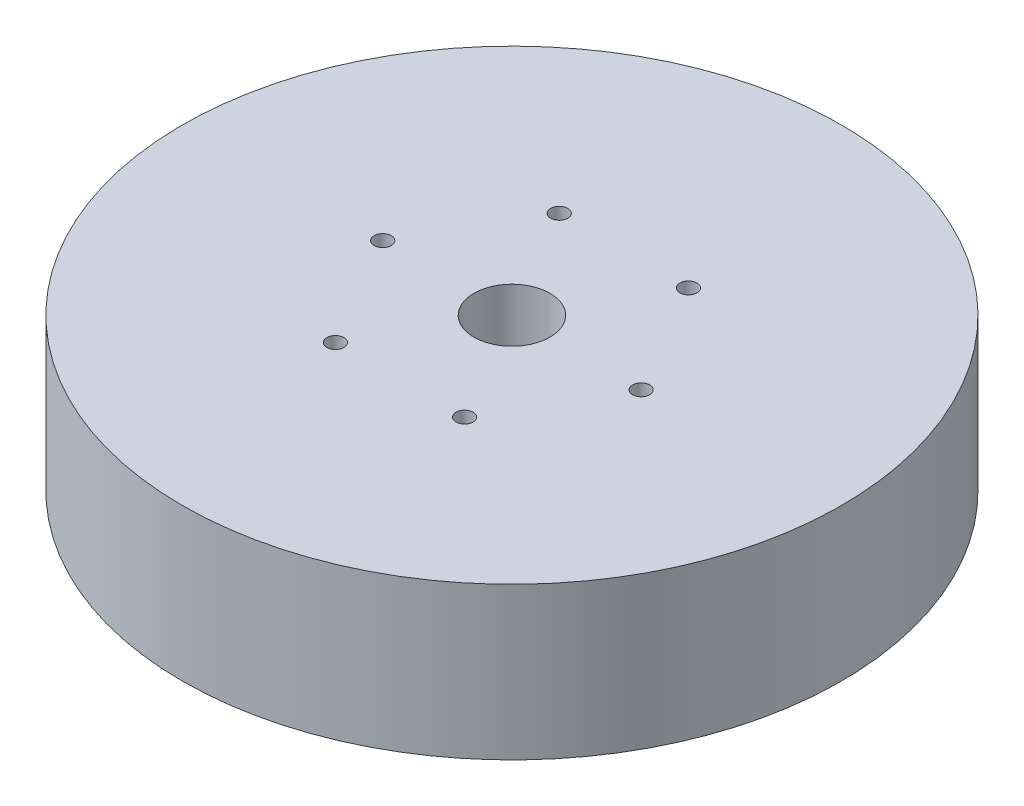
from build123d import *

# Parameters (mm, degrees)
SKETCH1_R           = 65
BOSS_EXTRUDE1_DEPTH = 30
SKETCH2_R           = 7.5
CUT_EXTRUDE1_DEPTH  = 97.695398029
SKETCH3_R           = 1.690063263
CUT_EXTRUDE2_DEPTH  = 20.324144327
CIRPATTERN1_COUNT   = 6


with BuildPart() as part:
    # Sketch1 → Boss-Extrude1 (new body)
    with BuildSketch(Plane(origin=(0, 0, 0), x_dir=(1, 0, 0), z_dir=(0, 1, 0))):
        Circle(SKETCH1_R)
    extrude(amount=BOSS_EXTRUDE1_DEPTH)

    # Sketch2 → Cut-Extrude1 (cut, through all)
    with BuildSketch(Plane(origin=(0, 0, 0), x_dir=(1, 0, 0), z_dir=(0, 1, 0))):
        Circle(SKETCH2_R)
    extrude(amount=CUT_EXTRUDE1_DEPTH, mode=Mode.SUBTRACT)

    # Sketch3 → Cut-Extrude2 (cut)
    with BuildSketch(Plane(origin=(0, 30, 0), x_dir=(1, 0, 0), z_dir=(0, 1, 0))):
        with Locations((-25.484712712, 0)):
            Circle(SKETCH3_R)
    cut_extrude2 = extrude(amount=-CUT_EXTRUDE2_DEPTH, mode=Mode.SUBTRACT)

    # CirPattern1: Cut-Extrude2 ×6 about axis
    cirpattern1_axis = Axis((0, 0, 0), (0, 1, 0))
    for i in range(1, CIRPATTERN1_COUNT):
        add(cut_extrude2.rotate(cirpattern1_axis, i * 360 / CIRPATTERN1_COUNT), mode=Mode.SUBTRACT)


solid = part.part
